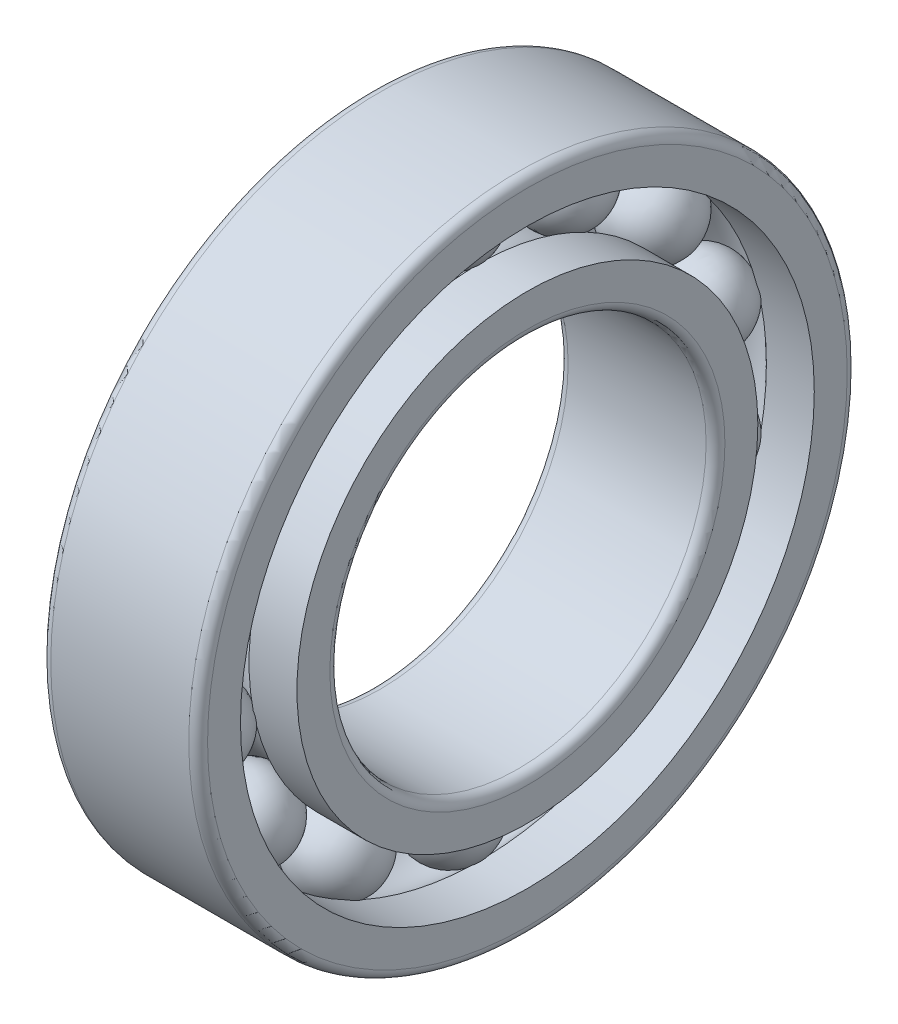
from build123d import *

# Parameters (mm, degrees)
CAGSPISKE_W         = 0.27
CAGSPISKE_H         = 0.45
CAGESPINE_ANGLE     = 0.001
BALLSDETAILED_COUNT = 14
BALLSDETAILED_ANGLE = 334.285714286


with BuildPart() as part:
    # CagSpiSke → CageSpine (revolve)
    with BuildSketch(Plane.XY):
        with Locations((0, 8.25)):
            Rectangle(CAGSPISKE_W, CAGSPISKE_H)
    revolve(axis=Axis((-20.6375, 0, 0), (-1, 0, 0)), revolution_arc=CAGESPINE_ANGLE)

    # BalDetSke → BallDetailed (revolve)
    with BuildSketch(Plane.XY):
        with BuildLine():
            Line((-1.35, 8.25), (1.35, 8.25))
            ThreePointArc((1.35, 8.25), (0, 6.9), (-1.35, 8.25))
        make_face()
    balldetailed = revolve(axis=Axis((-1.905, 8.25, 0), (1, 0, 0)))

    # InnRacSke → InnerRace (revolve)
    with BuildSketch(Plane.XY):
        with BuildLine():
            Line((-0.972432517, 7.35), (-2.5, 7.35))
            Line((-2.5, 7.35), (-2.5, 6.3))
            ThreePointArc((-2.5, 6.3), (-2.412132034, 6.087867966), (-2.2, 6))
            Line((-2.2, 6), (2.2, 6))
            ThreePointArc((2.2, 6), (2.412132034, 6.087867966), (2.5, 6.3))
            Line((2.5, 6.3), (2.5, 7.35))
            Line((2.5, 7.35), (0.972432517, 7.35))
            ThreePointArc((0.972432517, 7.35), (0, 6.925), (-0.972432517, 7.35))
        make_face()
    revolve(axis=Axis((-20.6375, 0, 0), (1, 0, 0)))

    # OutRacSke → OuterRace (revolve)
    with BuildSketch(Plane.XY):
        with BuildLine():
            Line((-0.972432517, 9.15), (-2.5, 9.15))
            Line((-2.5, 9.15), (-2.5, 10.2))
            ThreePointArc((-2.5, 10.2), (-2.412132034, 10.412132034), (-2.2, 10.5))
            Line((-2.2, 10.5), (2.2, 10.5))
            ThreePointArc((2.2, 10.5), (2.412132034, 10.412132034), (2.5, 10.2))
            Line((2.5, 10.2), (2.5, 9.15))
            Line((2.5, 9.15), (0.972432517, 9.15))
            ThreePointArc((0.972432517, 9.15), (0, 9.575), (-0.972432517, 9.15))
        make_face()
    revolve(axis=Axis((-20.6375, 0, 0), (1, 0, 0)))

    # BallsDetailed: BallDetailed ×14 about axis
    ballsdetailed_axis = Axis((-50, 0, 0), (1, 0, 0))
    for i in range(1, BALLSDETAILED_COUNT):
        add(balldetailed.rotate(ballsdetailed_axis, i * BALLSDETAILED_ANGLE / (BALLSDETAILED_COUNT - 1)))


solid = part.part
